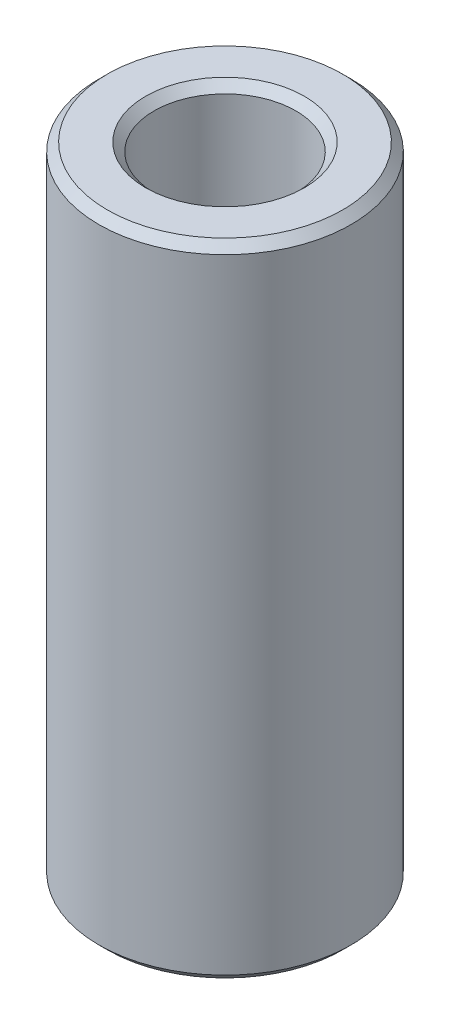
from build123d import *

# Parameters (mm, degrees)
SKETCH1_R           = 47.5
BOSS_EXTRUDE1_DEPTH = 241.330209341
SKETCH2_R           = 26.711942294
CUT_EXTRUDE1_DEPTH  = 251.505029771
CHAMFER1_SIZE       = 3.180699272


with BuildPart() as part:
    # Sketch1 → Boss-Extrude1 (new body)
    with BuildSketch(Plane(origin=(0, 0, 0), x_dir=(1, 0, 0), z_dir=(0, 1, 0))):
        Circle(SKETCH1_R)
    extrude(amount=BOSS_EXTRUDE1_DEPTH)

    # Sketch2 → Cut-Extrude1 (cut, through all)
    with BuildSketch(Plane(origin=(0, 0, 0), x_dir=(1, 0, 0), z_dir=(0, 1, 0))):
        Circle(SKETCH2_R)
    extrude(amount=CUT_EXTRUDE1_DEPTH, mode=Mode.SUBTRACT)

    # Chamfer1
    chamfer1_edges = [part.edges().sort_by_distance(p)[0] for p in [
        (-26.711942294, 241.330209341, 0),
        (-26.711942294, 0, 0),
        (-47.5, 0, 0),
        (-47.5, 241.330209341, 0),
    ]]
    chamfer(chamfer1_edges, length=CHAMFER1_SIZE)


solid = part.part
